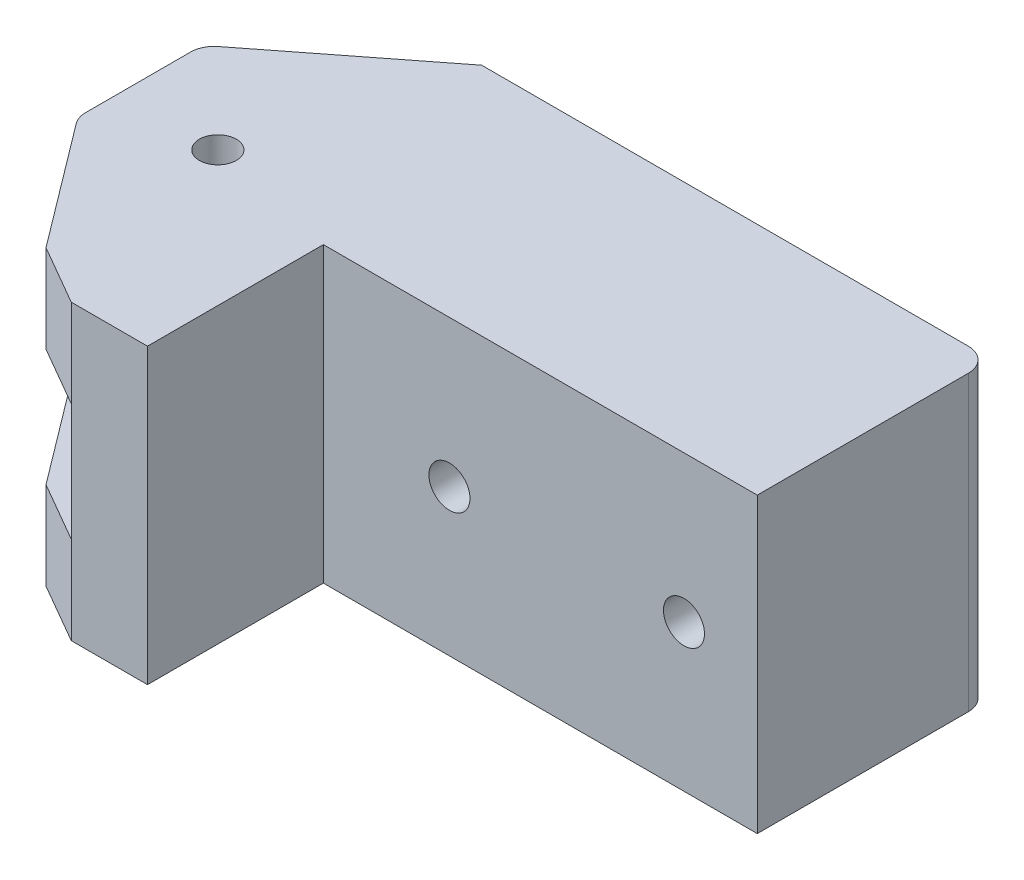
from build123d import *

# Parameters (mm, degrees)
SKETCH1_R           = 1.575
BOSS_EXTRUDE1_DEPTH = 12.5
SKETCH2_W           = 13.385271969
SKETCH2_H           = 10
CUT_EXTRUDE1_DEPTH  = 68.949865099
SKETCH3_R           = 1.75
CUT_EXTRUDE2_DEPTH  = 25
SKETCH4_R           = 4
CUT_EXTRUDE3_DEPTH  = 4
FILLET1_R           = 2


with BuildPart() as part:
    # Sketch1 → Boss-Extrude1 (new, symmetric)
    with BuildSketch(Plane(origin=(0, 0, 0), x_dir=(1, 0, 0), z_dir=(0, 1, 0))):
        Polygon((0, 0), (-43.5, 0), (-56.885271969, -10.457720596), (-56.885271969, -21.057720596), (-48.596177418, -32.057720596), (-43.5, -35), (-37, -35), (-37, -20), (0, -20), align=None)
        with Locations((-48.5, -17.5)):
            Circle(SKETCH1_R, mode=Mode.SUBTRACT)
    extrude(amount=BOSS_EXTRUDE1_DEPTH, both=True)

    # Sketch2 → Cut-Extrude1 (cut, through all)
    with BuildSketch(Plane.XY.offset(35)):
        with Locations((-50.192635985, 0)):
            Rectangle(SKETCH2_W, SKETCH2_H)
    extrude(amount=-CUT_EXTRUDE1_DEPTH, mode=Mode.SUBTRACT)

    # Sketch3 → Cut-Extrude2 (cut)
    with BuildSketch(Plane.XY.offset(20)):
        with Locations((-26.25, 0)):
            Circle(SKETCH3_R)
        with Locations((-6.25, 0)):
            Circle(SKETCH3_R)
    extrude(amount=-CUT_EXTRUDE2_DEPTH, mode=Mode.SUBTRACT)

    # Sketch4 → Cut-Extrude3 (cut)
    with BuildSketch(Plane(origin=(0, 0, 0), x_dir=(-1, 0, 0), z_dir=(0, 0, -1))):
        with Locations((6.25, 0)):
            Circle(SKETCH4_R)
        with Locations((26.25, 0)):
            Circle(SKETCH4_R)
    extrude(amount=-CUT_EXTRUDE3_DEPTH, mode=Mode.SUBTRACT)

    # Fillet1
    fillet1_edges = [part.edges().sort_by_distance(p)[0] for p in [
        (0, 0, 0),
        (-56.885271969, 8.75, 10.457720596),
        (-56.885271969, 8.75, 21.057720596),
        (-56.885271969, -8.75, 21.057720596),
        (-56.885271969, -8.75, 10.457720596),
    ]]
    fillet(fillet1_edges, radius=FILLET1_R)


solid = part.part
